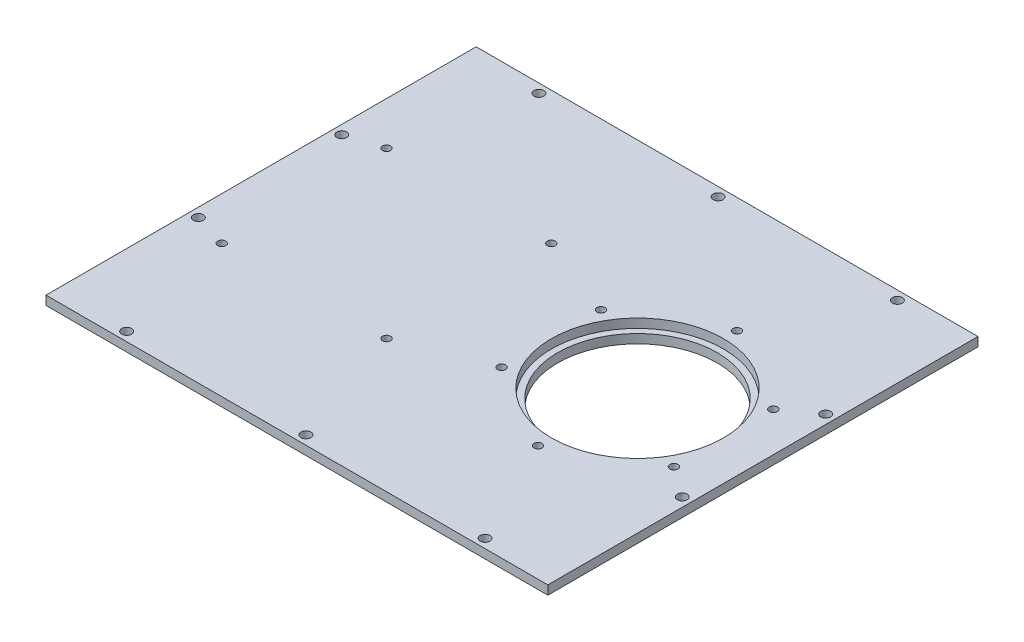
from build123d import *

# Parameters (mm, degrees)
CROQUIS1_W                                  = 280
CROQUIS1_H                                  = 240
SALIENTE_EXTRUIR1_DEPTH                     = 2.5
CROQUIS2_R                                  = 48
CORTAR_EXTRUIR1_DEPTH                       = 10
CROQUIS3_R                                  = 63
CROQUIS3_R_2                                = 44.5
SALIENTE_EXTRUIR2_DEPTH                     = 5
TALADRO_DE_MARGEN_PARA_M51_AT_2_COUNT       = 2
TALADRO_DE_MARGEN_PARA_M51_AT_2_PITCH       = 200
TALADRO_DE_MARGEN_PARA_M51_AT_3_COUNT       = 2
TALADRO_DE_MARGEN_PARA_M51_AT_3_PITCH       = 246.677927671
TALADRO_DE_MARGEN_PARA_M51_AT_4_COUNT       = 2
TALADRO_DE_MARGEN_PARA_M51_AT_4_PITCH       = 281.513765205
TALADRO_DE_MARGEN_PARA_M51_AT_5_COUNT       = 2
TALADRO_DE_MARGEN_PARA_M51_AT_5_PITCH       = 304.795013083
TALADRO_DE_MARGEN_PARA_M51_AT_6_COUNT       = 2
TALADRO_DE_MARGEN_PARA_M51_AT_6_PITCH       = 230
TALADRO_DE_MARGEN_PARA_M51_AT_7_COUNT       = 2
TALADRO_DE_MARGEN_PARA_M51_AT_7_PITCH       = 158.902485821
TALADRO_DE_MARGEN_PARA_M51_AT_8_COUNT       = 2
TALADRO_DE_MARGEN_PARA_M51_AT_8_PITCH       = 82.764726786
TALADRO_DE_MARGEN_PARA_M51_AT_9_COUNT       = 2
TALADRO_DE_MARGEN_PARA_M51_AT_9_PITCH       = 100
TALADRO_DE_MARGEN_PARA_M51_AT_10_COUNT      = 2
TALADRO_DE_MARGEN_PARA_M51_AT_10_PITCH      = 250.79872408
REFRENTADO_PARA_TORNILLO_CON_CABEZA_2_COUNT = 2
REFRENTADO_PARA_TORNILLO_CON_CABEZA_2_PITCH = 55.5
REFRENTADO_PARA_TORNILLO_CON_CABEZA_3_COUNT = 2
REFRENTADO_PARA_TORNILLO_CON_CABEZA_3_PITCH = 96.12881982
REFRENTADO_PARA_TORNILLO_CON_CABEZA_4_COUNT = 2
REFRENTADO_PARA_TORNILLO_CON_CABEZA_4_PITCH = 111
REFRENTADO_PARA_TORNILLO_CON_CABEZA_5_COUNT = 2
REFRENTADO_PARA_TORNILLO_CON_CABEZA_5_PITCH = 96.12881982
REFRENTADO_PARA_TORNILLO_CON_CABEZA_6_COUNT = 2
REFRENTADO_PARA_TORNILLO_CON_CABEZA_6_PITCH = 55.5
TALADRO_START                               = -2.5
TALADRO_DE_MARGEN_PARA_M41_OUTLINE_R        = 2.25
TALADRO_DE_MARGEN_PARA_M41_DEPTH            = 5


# Read off the part's stored shape, not the designer's step: Taladro de margen para M41
with BuildPart() as part:
    # Croquis1 → Saliente-Extruir1 (new, symmetric)
    with BuildSketch(Plane(origin=(0, 0, 0), x_dir=(1, 0, 0), z_dir=(0, 1, 0))):
        Rectangle(CROQUIS1_W, CROQUIS1_H)
    extrude(amount=SALIENTE_EXTRUIR1_DEPTH, both=True)

    # Croquis2 → Cortar-Extruir1 (cut)
    with BuildSketch(Plane(origin=(0, 2.5, 0), x_dir=(1, 0, 0), z_dir=(0, 1, 0))):
        with Locations(Location((70, 0, 0), (0, 0, 270))):
            Circle(CROQUIS2_R)
    extrude(amount=-CORTAR_EXTRUIR1_DEPTH, mode=Mode.SUBTRACT)

    # Croquis8 → Taladro de margen para M51 (revolve, cut)
    with BuildSketch(Plane(origin=(-100, 2.5, -115), x_dir=(0, 0, 1), z_dir=(1, 0, 0))):
        Polygon((0, 0), (0, 11.652366702), (2.75, 10), (2.75, 0), align=None)
    taladro_de_margen_para_m51 = revolve(axis=Axis((-100, 8.85, -115), (0, -1, 0)), mode=Mode.SUBTRACT)

    # Taladro de margen para M51 at 2: Taladro de margen para M51 ×2
    with Locations(*[(i * TALADRO_DE_MARGEN_PARA_M51_AT_2_PITCH, 0, 0) for i in range(1, TALADRO_DE_MARGEN_PARA_M51_AT_2_COUNT)]):
        add(taladro_de_margen_para_m51, mode=Mode.SUBTRACT)

    # Taladro de margen para M51 at 3: Taladro de margen para M51 ×2
    with Locations(*[Vector(0.9526592112186828, 0, 0.30404017379319676) * (i * TALADRO_DE_MARGEN_PARA_M51_AT_3_PITCH) for i in range(1, TALADRO_DE_MARGEN_PARA_M51_AT_3_COUNT)]):
        add(taladro_de_margen_para_m51, mode=Mode.SUBTRACT)

    # Taladro de margen para M51 at 4: Taladro de margen para M51 ×2
    with Locations(*[Vector(0.8347726791573308, 0, 0.5505947458271757) * (i * TALADRO_DE_MARGEN_PARA_M51_AT_4_PITCH) for i in range(1, TALADRO_DE_MARGEN_PARA_M51_AT_4_COUNT)]):
        add(taladro_de_margen_para_m51, mode=Mode.SUBTRACT)

    # Taladro de margen para M51 at 5: Taladro de margen para M51 ×2
    with Locations(*[Vector(0.6561787149247867, 0, 0.7546055221635047) * (i * TALADRO_DE_MARGEN_PARA_M51_AT_5_PITCH) for i in range(1, TALADRO_DE_MARGEN_PARA_M51_AT_5_COUNT)]):
        add(taladro_de_margen_para_m51, mode=Mode.SUBTRACT)

    # Taladro de margen para M51 at 6: Taladro de margen para M51 ×2
    with Locations(*[(0, 0, i * TALADRO_DE_MARGEN_PARA_M51_AT_6_PITCH) for i in range(1, TALADRO_DE_MARGEN_PARA_M51_AT_6_COUNT)]):
        add(taladro_de_margen_para_m51, mode=Mode.SUBTRACT)

    # Taladro de margen para M51 at 7: Taladro de margen para M51 ×2
    with Locations(*[Vector(-0.22026087143464337, 0, 0.9754410020677066) * (i * TALADRO_DE_MARGEN_PARA_M51_AT_7_PITCH) for i in range(1, TALADRO_DE_MARGEN_PARA_M51_AT_7_COUNT)]):
        add(taladro_de_margen_para_m51, mode=Mode.SUBTRACT)

    # Taladro de margen para M51 at 8: Taladro de margen para M51 ×2
    with Locations(*[Vector(-0.42288546533112376, 0, 0.9061831399952656) * (i * TALADRO_DE_MARGEN_PARA_M51_AT_8_PITCH) for i in range(1, TALADRO_DE_MARGEN_PARA_M51_AT_8_COUNT)]):
        add(taladro_de_margen_para_m51, mode=Mode.SUBTRACT)

    # Taladro de margen para M51 at 9: Taladro de margen para M51 ×2
    with Locations(*[(i * TALADRO_DE_MARGEN_PARA_M51_AT_9_PITCH, 0, 0) for i in range(1, TALADRO_DE_MARGEN_PARA_M51_AT_9_COUNT)]):
        add(taladro_de_margen_para_m51, mode=Mode.SUBTRACT)

    # Taladro de margen para M51 at 10: Taladro de margen para M51 ×2
    with Locations(*[Vector(0.39872611141444997, 0, 0.917070056253235) * (i * TALADRO_DE_MARGEN_PARA_M51_AT_10_PITCH) for i in range(1, TALADRO_DE_MARGEN_PARA_M51_AT_10_COUNT)]):
        add(taladro_de_margen_para_m51, mode=Mode.SUBTRACT)


with BuildPart() as body_2:
    # Croquis3 → Saliente-Extruir2 (new body)
    with BuildSketch(Plane.XZ.offset(2.5)):
        with Locations(Location((70, 0, 0), (0, 0, 270))):
            Circle(CROQUIS3_R)
        with Locations(Location((70, 0, 0), (0, 0, 270))):
            Circle(CROQUIS3_R_2, mode=Mode.SUBTRACT)
    extrude(amount=SALIENTE_EXTRUIR2_DEPTH)


with BuildPart() as refrentado_para_tornillo_con_cabeza_tron_tool:
    # Croquis11 → Refrentado para tornillo con cabeza troncocónica de M41 (revolve)
    with BuildSketch(Plane(origin=(70, -7.5, 55.5), x_dir=(0, 0, -1), z_dir=(1, 0, 0))):
        Polygon((0, 0), (0, 21.351936393), (2.25, 20), (2.25, 3.1), (4.5, 3.1), (4.5, 0), align=None)
    refrentado_para_tornillo_con_cabeza_tron = revolve(axis=Axis((70, -13.85, 55.5), (0, 1, 0)))


with BuildPart() as part_1:
    add(part.part)

    # Refrentado para tornillo con cabeza troncocónica de M41: cut by refrentado_para_tornillo_con_cabeza_tron_tool
    add(refrentado_para_tornillo_con_cabeza_tron_tool.part, mode=Mode.SUBTRACT)


with BuildPart() as body_2_1:
    add(body_2.part)

    # Refrentado para tornillo con cabeza troncocónica de M41: cut by refrentado_para_tornillo_con_cabeza_tron_tool
    add(refrentado_para_tornillo_con_cabeza_tron_tool.part, mode=Mode.SUBTRACT)


with BuildPart() as refrentado_para_tornillo_con_cabeza_2_tool:
    # Refrentado para tornillo con cabeza  2: Refrentado para tornillo con cabeza troncocónica de M41 ×2
    with Locations(*[Vector(0.8660254037844387, 0, -0.49999999999999994) * (i * REFRENTADO_PARA_TORNILLO_CON_CABEZA_2_PITCH) for i in range(1, REFRENTADO_PARA_TORNILLO_CON_CABEZA_2_COUNT)]):
        add(refrentado_para_tornillo_con_cabeza_tron)


with BuildPart() as part_2:
    add(part_1.part)

    # Refrentado para tornillo con cabeza  2: cut by refrentado_para_tornillo_con_cabeza_2_tool
    add(refrentado_para_tornillo_con_cabeza_2_tool.part, mode=Mode.SUBTRACT)


with BuildPart() as body_2_2:
    add(body_2_1.part)

    # Refrentado para tornillo con cabeza  2: cut by refrentado_para_tornillo_con_cabeza_2_tool
    add(refrentado_para_tornillo_con_cabeza_2_tool.part, mode=Mode.SUBTRACT)


with BuildPart() as refrentado_para_tornillo_con_cabeza_3_tool:
    # Refrentado para tornillo con cabeza  3: Refrentado para tornillo con cabeza troncocónica de M41 ×2
    with Locations(*[Vector(0.5000000000000001, 0, -0.8660254037844387) * (i * REFRENTADO_PARA_TORNILLO_CON_CABEZA_3_PITCH) for i in range(1, REFRENTADO_PARA_TORNILLO_CON_CABEZA_3_COUNT)]):
        add(refrentado_para_tornillo_con_cabeza_tron)


with BuildPart() as part_3:
    add(part_2.part)

    # Refrentado para tornillo con cabeza  3: cut by refrentado_para_tornillo_con_cabeza_3_tool
    add(refrentado_para_tornillo_con_cabeza_3_tool.part, mode=Mode.SUBTRACT)


with BuildPart() as body_2_3:
    add(body_2_2.part)

    # Refrentado para tornillo con cabeza  3: cut by refrentado_para_tornillo_con_cabeza_3_tool
    add(refrentado_para_tornillo_con_cabeza_3_tool.part, mode=Mode.SUBTRACT)


with BuildPart() as refrentado_para_tornillo_con_cabeza_4_tool:
    # Refrentado para tornillo con cabeza  4: Refrentado para tornillo con cabeza troncocónica de M41 ×2
    with Locations(*[(0, 0, -i * REFRENTADO_PARA_TORNILLO_CON_CABEZA_4_PITCH) for i in range(1, REFRENTADO_PARA_TORNILLO_CON_CABEZA_4_COUNT)]):
        add(refrentado_para_tornillo_con_cabeza_tron)


with BuildPart() as part_4:
    add(part_3.part)

    # Refrentado para tornillo con cabeza  4: cut by refrentado_para_tornillo_con_cabeza_4_tool
    add(refrentado_para_tornillo_con_cabeza_4_tool.part, mode=Mode.SUBTRACT)


with BuildPart() as body_2_4:
    add(body_2_3.part)

    # Refrentado para tornillo con cabeza  4: cut by refrentado_para_tornillo_con_cabeza_4_tool
    add(refrentado_para_tornillo_con_cabeza_4_tool.part, mode=Mode.SUBTRACT)


with BuildPart() as refrentado_para_tornillo_con_cabeza_5_tool:
    # Refrentado para tornillo con cabeza  5: Refrentado para tornillo con cabeza troncocónica de M41 ×2
    with Locations(*[Vector(-0.4999999999999997, 0, -0.8660254037844388) * (i * REFRENTADO_PARA_TORNILLO_CON_CABEZA_5_PITCH) for i in range(1, REFRENTADO_PARA_TORNILLO_CON_CABEZA_5_COUNT)]):
        add(refrentado_para_tornillo_con_cabeza_tron)


with BuildPart() as part_5:
    add(part_4.part)

    # Refrentado para tornillo con cabeza  5: cut by refrentado_para_tornillo_con_cabeza_5_tool
    add(refrentado_para_tornillo_con_cabeza_5_tool.part, mode=Mode.SUBTRACT)


with BuildPart() as body_2_5:
    add(body_2_4.part)

    # Refrentado para tornillo con cabeza  5: cut by refrentado_para_tornillo_con_cabeza_5_tool
    add(refrentado_para_tornillo_con_cabeza_5_tool.part, mode=Mode.SUBTRACT)


with BuildPart() as refrentado_para_tornillo_con_cabeza_6_tool:
    # Refrentado para tornillo con cabeza  6: Refrentado para tornillo con cabeza troncocónica de M41 ×2
    with Locations(*[Vector(-0.8660254037844388, 0, -0.4999999999999997) * (i * REFRENTADO_PARA_TORNILLO_CON_CABEZA_6_PITCH) for i in range(1, REFRENTADO_PARA_TORNILLO_CON_CABEZA_6_COUNT)]):
        add(refrentado_para_tornillo_con_cabeza_tron)


with BuildPart() as part_6:
    add(part_5.part)

    # Refrentado para tornillo con cabeza  6: cut by refrentado_para_tornillo_con_cabeza_6_tool
    add(refrentado_para_tornillo_con_cabeza_6_tool.part, mode=Mode.SUBTRACT)

    # Taladro de margen para M41 outline → Taladro de margen para M41 (cut)
    with BuildSketch(Plane(origin=(0, 0, 0), x_dir=(1, 0, 0), z_dir=(0, 1, 0)).offset(TALADRO_START)):
        with Locations((-24.038059223, -45.961940777)):
            Circle(TALADRO_DE_MARGEN_PARA_M41_OUTLINE_R)
        with Locations((-115.961940777, 45.961940777)):
            Circle(TALADRO_DE_MARGEN_PARA_M41_OUTLINE_R)
        with Locations((-115.961940777, -45.961940777)):
            Circle(TALADRO_DE_MARGEN_PARA_M41_OUTLINE_R)
        with Locations((-24.038059223, 45.961940777)):
            Circle(TALADRO_DE_MARGEN_PARA_M41_OUTLINE_R)
    extrude(amount=TALADRO_DE_MARGEN_PARA_M41_DEPTH, mode=Mode.SUBTRACT)


with BuildPart() as body_2_6:
    add(body_2_5.part)

    # Refrentado para tornillo con cabeza  6: cut by refrentado_para_tornillo_con_cabeza_6_tool
    add(refrentado_para_tornillo_con_cabeza_6_tool.part, mode=Mode.SUBTRACT)


solid = Compound([part_6.part, body_2_6.part])
